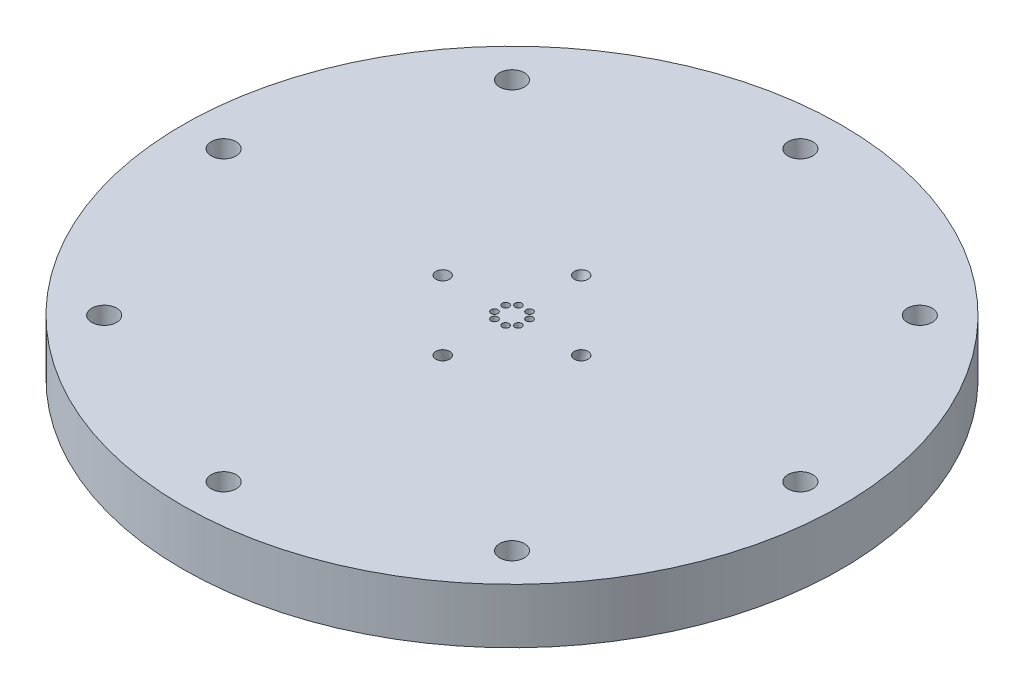
from build123d import *

# Parameters (mm, degrees)
SKETCH1_R                                      = 38.1
BOSS_EXTRUDE1_DEPTH                            = 6.35
CBORE_FOR_4_BUTTON_HEAD_CAP_SCREW1_D           = 2.8702
CBORE_FOR_4_BUTTON_HEAD_CAP_SCREW1_CBORE_D     = 4.826
CBORE_FOR_4_BUTTON_HEAD_CAP_SCREW1_CBORE_DEPTH = 1.905
CIRPATTERN1_COUNT                              = 8
SKETCH6_R                                      = 0.396875
CUT_EXTRUDE1_DEPTH                             = 55.254423783
CIRPATTERN2_COUNT                              = 4
SKETCH7_R                                      = 0.79375


with BuildPart() as part:
    # Sketch1 → Boss-Extrude1 (new body)
    with BuildSketch(Plane(origin=(0, 0, 0), x_dir=(1, 0, 0), z_dir=(0, 1, 0))):
        with Locations(Location((0, 0, 0), (0, 0, 270))):
            Circle(SKETCH1_R)
    extrude(amount=BOSS_EXTRUDE1_DEPTH)

    # CBORE for #4 Button Head Cap Screw1 (through all)
    with Locations(Plane(origin=(0, 0, 0), x_dir=(-1, 0, 0), z_dir=(0, -1, 0))):
        with Locations((0, -33.3375)):
            cbore_for_4_button_head_cap_screw1 = CounterBoreHole(CBORE_FOR_4_BUTTON_HEAD_CAP_SCREW1_D / 2, CBORE_FOR_4_BUTTON_HEAD_CAP_SCREW1_CBORE_D / 2, CBORE_FOR_4_BUTTON_HEAD_CAP_SCREW1_CBORE_DEPTH)

    # CirPattern1: CBORE for #4 Button Head Cap Screw1 ×8 about axis
    cirpattern1_axis = Axis((0, 0, 0), (0, 1, 0))
    for i in range(1, CIRPATTERN1_COUNT):
        add(cbore_for_4_button_head_cap_screw1.rotate(cirpattern1_axis, i * 360 / CIRPATTERN1_COUNT), mode=Mode.SUBTRACT)

    # Sketch6 → Cut-Extrude1 (cut, through all)
    with BuildSketch(Plane.XZ):
        with Locations(Location((-0.644070231, -1.381213067, 0), (0, 0, 270))):
            Circle(SKETCH6_R)
        with Locations(Location((-1.381213067, -0.644070231, 0), (0, 0, 270))):
            Circle(SKETCH6_R)
    cut_extrude1 = extrude(amount=-CUT_EXTRUDE1_DEPTH, mode=Mode.SUBTRACT)

    # CirPattern2: Cut-Extrude1 ×4 about axis
    cirpattern2_axis = Axis((0.000227094, 0, 0.000227094), (0, 1, 0))
    for i in range(1, CIRPATTERN2_COUNT):
        add(cut_extrude1.rotate(cirpattern2_axis, i * 360 / CIRPATTERN2_COUNT), mode=Mode.SUBTRACT)

    # Cut-Sweep1: sweep along a curve in space
    with BuildLine() as cut_sweep1_path:
        Line((0, 6.35, -8.001), (0, 0, -6.35))
    # Sketch7 → Cut-Sweep1 (sweep, cut)
    with BuildSketch(Plane(origin=(0, 6.35, 0), x_dir=(1, 0, 0), z_dir=(0, 1, 0))):
        with Locations((0, 8.001)):
            Circle(SKETCH7_R)
    sweep(path=cut_sweep1_path.line, mode=Mode.SUBTRACT)

    # CirPattern3: read off the stored shape, not the designer's step
    # CirPattern3: loft between two sections, ruled curve by curve
    cirpattern3_from = [
        Edge.make_bspline([(-7.470778066, 7.350046313, 0.003515494), (-7.470778066, 7.350046313, -1.583984506), (-9.058278066, 7.350046313, -1.583984506), (-9.058278066, 7.350046313, 0.003515494), (-9.058278066, 7.350046313, 1.591015494), (-7.470778066, 7.350046313, 1.591015494), (-7.470778066, 7.350046313, 0.003515494)], [0, 0, 0, 0, 0.5, 0.5, 0.5, 1, 1, 1, 1], 3, [1, 0.333333333, 0.333333333, 1, 0.333333333, 0.333333333, 1]),
    ]
    cirpattern3_to = [
        Edge.make_bspline([(-5.299753984, -1.000046313, 0.003515494), (-5.299753984, -1.000046313, -1.583984506), (-6.887253984, -1.000046313, -1.583984506), (-6.887253984, -1.000046313, 0.003515494), (-6.887253984, -1.000046313, 1.591015494), (-5.299753984, -1.000046313, 1.591015494), (-5.299753984, -1.000046313, 0.003515494)], [0, 0, 0, 0, 0.5, 0.5, 0.5, 1, 1, 1, 1], 3, [1, 0.333333333, 0.333333333, 1, 0.333333333, 0.333333333, 1]),
    ]
    cirpattern3 = Solid(Shell([*[Face.make_surface_from_curves(cirpattern3_from[k], cirpattern3_to[k]) for k in range(1)], Face(Wire(cirpattern3_from)), Face(Wire(cirpattern3_to))]))
    add(cirpattern3, mode=Mode.SUBTRACT)

    # CirPattern3 2: loft between two sections, ruled curve by curve
    cirpattern3_2_from = [
        Edge.make_bspline([(-5.31e-07, 7.350046313, 7.474293561), (-1.587500531, 7.350046313, 7.474293561), (-1.587500531, 7.350046313, 9.061793561), (-5.31e-07, 7.350046313, 9.061793561), (1.587499469, 7.350046313, 9.061793561), (1.587499469, 7.350046313, 7.474293561), (-5.31e-07, 7.350046313, 7.474293561)], [0, 0, 0, 0, 0.5, 0.5, 0.5, 1, 1, 1, 1], 3, [1, 0.333333333, 0.333333333, 1, 0.333333333, 0.333333333, 1]),
    ]
    cirpattern3_2_to = [
        Edge.make_bspline([(-5.31e-07, -1.000046313, 5.303269478), (-1.587500531, -1.000046313, 5.303269478), (-1.587500531, -1.000046313, 6.890769478), (-5.31e-07, -1.000046313, 6.890769478), (1.587499469, -1.000046313, 6.890769478), (1.587499469, -1.000046313, 5.303269478), (-5.31e-07, -1.000046313, 5.303269478)], [0, 0, 0, 0, 0.5, 0.5, 0.5, 1, 1, 1, 1], 3, [1, 0.333333333, 0.333333333, 1, 0.333333333, 0.333333333, 1]),
    ]
    cirpattern3_2 = Solid(Shell([*[Face.make_surface_from_curves(cirpattern3_2_from[k], cirpattern3_2_to[k]) for k in range(1)], Face(Wire(cirpattern3_2_from)), Face(Wire(cirpattern3_2_to))]))
    add(cirpattern3_2, mode=Mode.SUBTRACT)

    # CirPattern3 3: loft between two sections, ruled curve by curve
    cirpattern3_3_from = [
        Edge.make_bspline([(7.470777536, 7.350046313, 0.003516025), (7.470777536, 7.350046313, 1.591016025), (9.058277536, 7.350046313, 1.591016025), (9.058277536, 7.350046313, 0.003516025), (9.058277536, 7.350046313, -1.583983975), (7.470777536, 7.350046313, -1.583983975), (7.470777536, 7.350046313, 0.003516025)], [0, 0, 0, 0, 0.5, 0.5, 0.5, 1, 1, 1, 1], 3, [1, 0.333333333, 0.333333333, 1, 0.333333333, 0.333333333, 1]),
    ]
    cirpattern3_3_to = [
        Edge.make_bspline([(5.299753453, -1.000046313, 0.003516025), (5.299753453, -1.000046313, 1.591016025), (6.887253453, -1.000046313, 1.591016025), (6.887253453, -1.000046313, 0.003516025), (6.887253453, -1.000046313, -1.583983975), (5.299753453, -1.000046313, -1.583983975), (5.299753453, -1.000046313, 0.003516025)], [0, 0, 0, 0, 0.5, 0.5, 0.5, 1, 1, 1, 1], 3, [1, 0.333333333, 0.333333333, 1, 0.333333333, 0.333333333, 1]),
    ]
    cirpattern3_3 = Solid(Shell([*[Face.make_surface_from_curves(cirpattern3_3_from[k], cirpattern3_3_to[k]) for k in range(1)], Face(Wire(cirpattern3_3_from)), Face(Wire(cirpattern3_3_to))]))
    add(cirpattern3_3, mode=Mode.SUBTRACT)


solid = part.part
